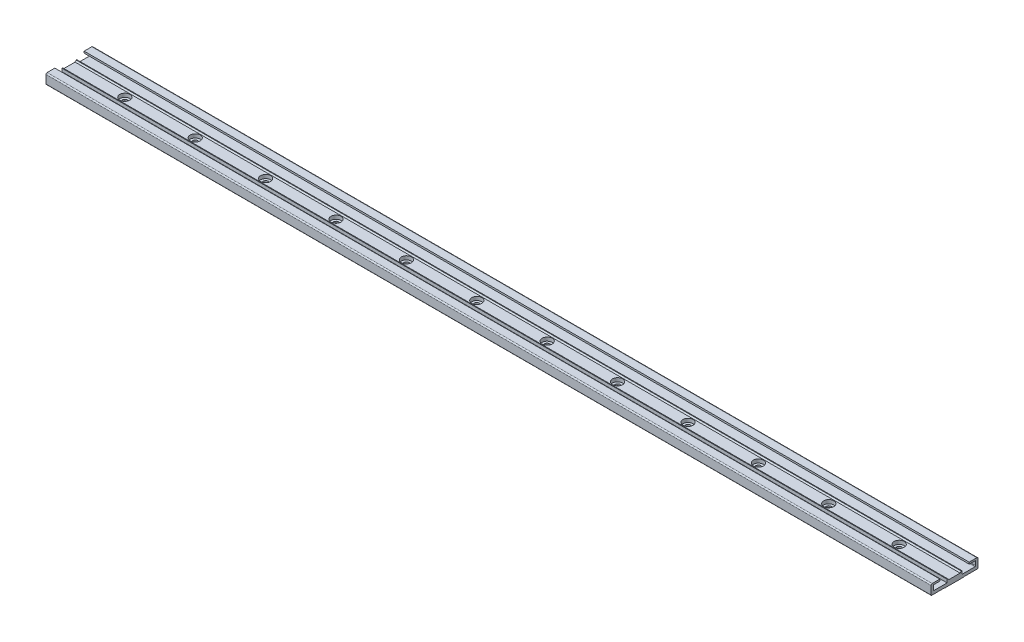
from build123d import *

# Parameters (mm, degrees)
BOSS_EXTRUDE1_DEPTH             = 754.38
CBORE_FOR_M4_SBHCS1_D           = 4.5
CBORE_FOR_M4_SBHCS1_CBORE_D     = 8.6
CBORE_FOR_M4_SBHCS1_CBORE_DEPTH = 3.1
LPATTERN1_COUNT                 = 12
LPATTERN1_PITCH                 = 60


with BuildPart() as part:
    # Sketch1 → Boss-Extrude1 (new body)
    with BuildSketch(Plane(origin=(0, 0, 0), x_dir=(0, 0, -1), z_dir=(1, 0, 0))):
        with BuildLine():
            Line((-8, 0.2), (-8, 0))
            Line((-8, 0), (8, 0))
            Line((8, 0), (8, 0.2))
            Line((8, 0.2), (19.5, 0.2))
            ThreePointArc((19.5, 0.2), (19.853553391, 0.346446609), (20, 0.7))
            Line((20, 0.7), (20, 7.7))
            ThreePointArc((20, 7.7), (19.707106781, 8.407106781), (19, 8.7))
            Line((19, 8.7), (12.5, 8.7))
            Line((12.5, 8.7), (12.5, 7.2))
            Line((12.5, 7.2), (17.5, 7.2))
            ThreePointArc((17.5, 7.2), (17.853553391, 7.053553391), (18, 6.7))
            Line((18, 6.7), (18, 3.3))
            ThreePointArc((18, 3.3), (17.853553391, 2.946446609), (17.5, 2.8))
            Line((17.5, 2.8), (6.3, 2.8))
            Line((6.3, 2.8), (6.3, 5.5))
            Line((6.3, 5.5), (5.75, 5.5))
            Line((5.75, 5.5), (4.75, 4.5))
            Line((4.75, 4.5), (-4.75, 4.5))
            Line((-4.75, 4.5), (-5.75, 5.5))
            Line((-5.75, 5.5), (-6.3, 5.5))
            Line((-6.3, 5.5), (-6.3, 2.8))
            Line((-6.3, 2.8), (-17.5, 2.8))
            ThreePointArc((-17.5, 2.8), (-17.853553391, 2.946446609), (-18, 3.3))
            Line((-18, 3.3), (-18, 6.7))
            ThreePointArc((-18, 6.7), (-17.853553391, 7.053553391), (-17.5, 7.2))
            Line((-17.5, 7.2), (-12.5, 7.2))
            Line((-12.5, 7.2), (-12.5, 8.7))
            Line((-12.5, 8.7), (-19, 8.7))
            ThreePointArc((-19, 8.7), (-19.707106781, 8.407106781), (-20, 7.7))
            Line((-20, 7.7), (-20, 0.7))
            ThreePointArc((-20, 0.7), (-19.853553391, 0.346446609), (-19.5, 0.2))
            Line((-19.5, 0.2), (-8, 0.2))
        make_face()
    extrude(amount=BOSS_EXTRUDE1_DEPTH)

    # CBORE for M4 SBHCS1 (through all)
    with Locations(Plane(origin=(0, 4.5, 0), x_dir=(1, 0, 0), z_dir=(0, 1, 0))):
        with Locations((47.19, 0)):
            cbore_for_m4_sbhcs1 = CounterBoreHole(CBORE_FOR_M4_SBHCS1_D / 2, CBORE_FOR_M4_SBHCS1_CBORE_D / 2, CBORE_FOR_M4_SBHCS1_CBORE_DEPTH)

    # LPattern1: CBORE for M4 SBHCS1 ×12
    with Locations(*[(i * LPATTERN1_PITCH, 0, 0) for i in range(1, LPATTERN1_COUNT)]):
        add(cbore_for_m4_sbhcs1, mode=Mode.SUBTRACT)


solid = part.part
